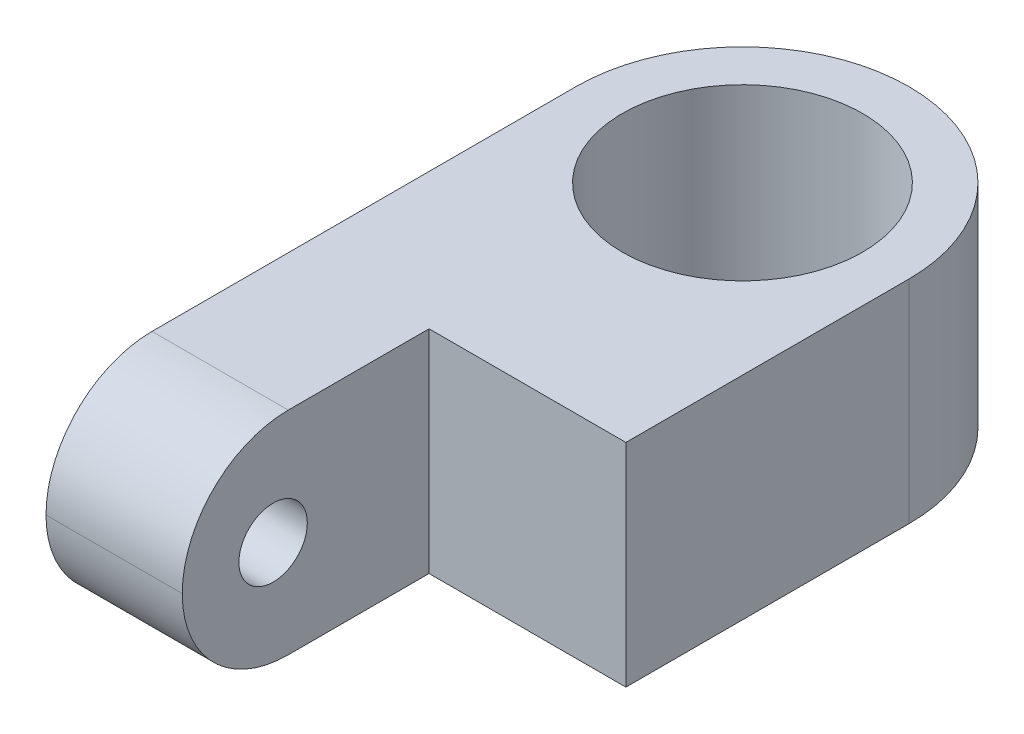
from build123d import *

# Parameters (mm, degrees)
SKETCH1_W             = 23
SKETCH1_H             = 7
BOSS_EXTRUDE1_DEPTH   = 5.5
SKETCH2_R             = 3.96875
CUT_EXTRUDE1_DEPTH    = 15.543039572
SKETCH3_W             = 8.15
SKETCH3_H             = 7
CUT_EXTRUDE2_DEPTH    = 6.5
F_4_40_TAPPED_HOLE1_D = 2.2606
FILLET1_R             = 3.5
FILLET2_R             = 5.5


with BuildPart() as part:
    # Sketch1 → Boss-Extrude1 (new, symmetric)
    with BuildSketch(Plane(origin=(0, 0, 0), x_dir=(0, 0, -1), z_dir=(1, 0, 0))):
        Rectangle(SKETCH1_W, SKETCH1_H)
    extrude(amount=BOSS_EXTRUDE1_DEPTH, both=True)

    # Sketch2 → Cut-Extrude1 (cut, through all)
    with BuildSketch(Plane(origin=(0, 3.5, 0), x_dir=(1, 0, 0), z_dir=(0, 1, 0))):
        with Locations(Location((0, 6, 0), (0, 0, 270))):
            Circle(SKETCH2_R)
    extrude(amount=-CUT_EXTRUDE1_DEPTH, mode=Mode.SUBTRACT)

    # Sketch3 → Cut-Extrude2 (cut)
    with BuildSketch(Plane(origin=(5.5, 0, 0), x_dir=(0, 0, -1), z_dir=(1, 0, 0))):
        with Locations((-7.425, 0)):
            Rectangle(SKETCH3_W, SKETCH3_H)
    extrude(amount=-CUT_EXTRUDE2_DEPTH, mode=Mode.SUBTRACT)

    # #4-40 Tapped Hole1 (through all)
    with Locations(Plane(origin=(-1, 0, 0), x_dir=(0, 0, -1), z_dir=(1, 0, 0))):
        with Locations((-8.5, -0.04)):
            Hole(F_4_40_TAPPED_HOLE1_D / 2)

    # Fillet1
    fillet1_edges = [part.edges().sort_by_distance(p)[0] for p in [
        (-3.25, -3.5, 11.5),
        (-3.25, 3.5, 11.5),
    ]]
    fillet(fillet1_edges, radius=FILLET1_R - 0.0001)  # a hair under: the kernel refuses the full size

    # Fillet2
    fillet2_edges = [part.edges().sort_by_distance(p)[0] for p in [
        (-5.5, 0, -11.5),
        (5.5, 0, -11.5),
    ]]
    fillet(fillet2_edges, radius=FILLET2_R - 0.0001)  # a hair under: the kernel refuses the full size


solid = part.part
